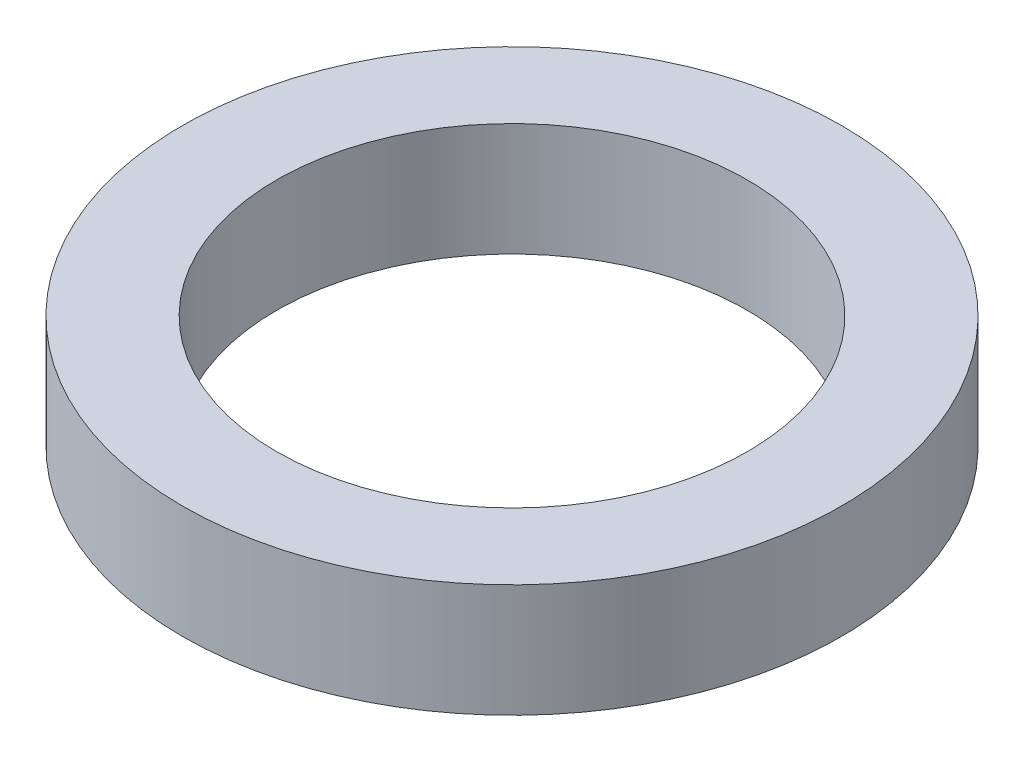
from build123d import *

# Parameters (mm, degrees)
SKETCH1_R           = 70
BOSS_EXTRUDE1_DEPTH = 24
SKETCH2_R           = 50
CUT_EXTRUDE1_DEPTH  = 102.862652626


with BuildPart() as part:
    # Sketch1 → Boss-Extrude1 (new body)
    with BuildSketch(Plane(origin=(0, 0, 0), x_dir=(1, 0, 0), z_dir=(0, 1, 0))):
        Circle(SKETCH1_R)
    extrude(amount=BOSS_EXTRUDE1_DEPTH)

    # Sketch2 → Cut-Extrude1 (cut, through all)
    with BuildSketch(Plane(origin=(0, 0, 0), x_dir=(1, 0, 0), z_dir=(0, 1, 0))):
        Circle(SKETCH2_R)
    extrude(amount=CUT_EXTRUDE1_DEPTH, mode=Mode.SUBTRACT)


solid = part.part
